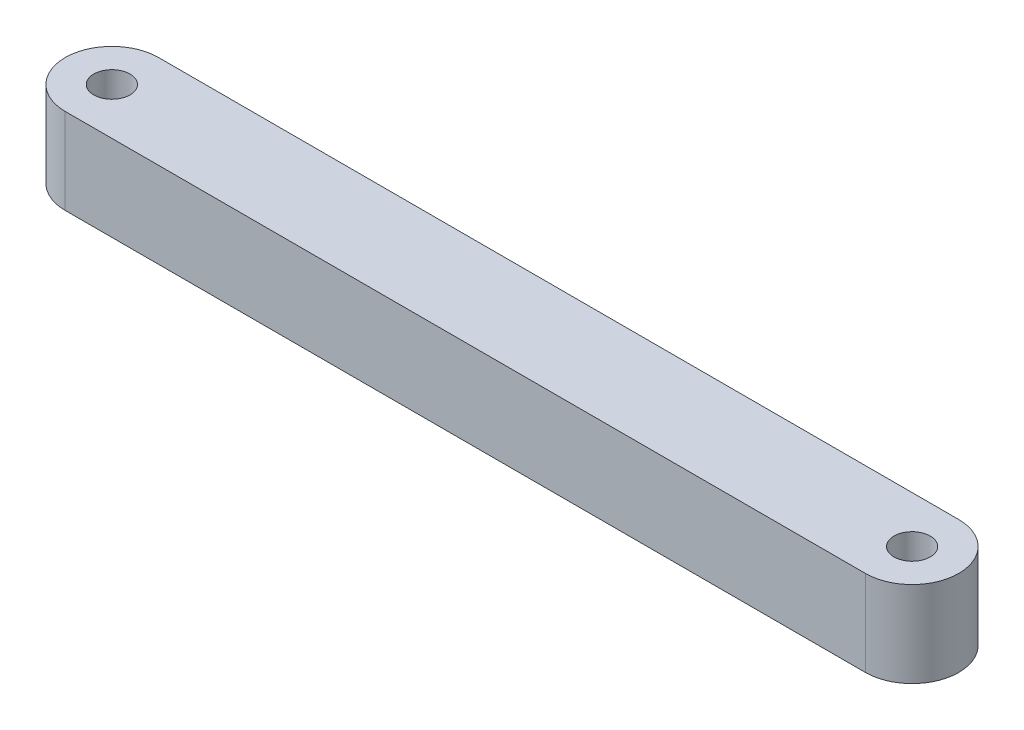
from build123d import *

# Parameters (mm, degrees)
BOSS_EXTRUDE1_DEPTH = 10.2108
SKETCH2_R           = 2.159
CUT_EXTRUDE1_DEPTH  = 102.474294231


with BuildPart() as part:
    # Sketch1 → Boss-Extrude1 (new body)
    with BuildSketch(Plane(origin=(0, 0, 0), x_dir=(1, 0, 0), z_dir=(0, 1, 0))):
        with BuildLine():
            Line((0, 5.55625), (95.25, 5.55625))
            ThreePointArc((95.25, 5.55625), (100.80625, 0), (95.25, -5.55625))
            Line((95.25, -5.55625), (0, -5.55625))
            ThreePointArc((0, -5.55625), (-5.55625, 0), (0, 5.55625))
        make_face()
    extrude(amount=BOSS_EXTRUDE1_DEPTH)

    # Sketch2 → Cut-Extrude1 (cut, through all)
    with BuildSketch(Plane(origin=(0, 10.2108, 0), x_dir=(1, 0, 0), z_dir=(0, 1, 0))):
        with Locations((95.25, 0)):
            Circle(SKETCH2_R)
        Circle(SKETCH2_R)
    extrude(amount=-CUT_EXTRUDE1_DEPTH, mode=Mode.SUBTRACT)


solid = part.part
